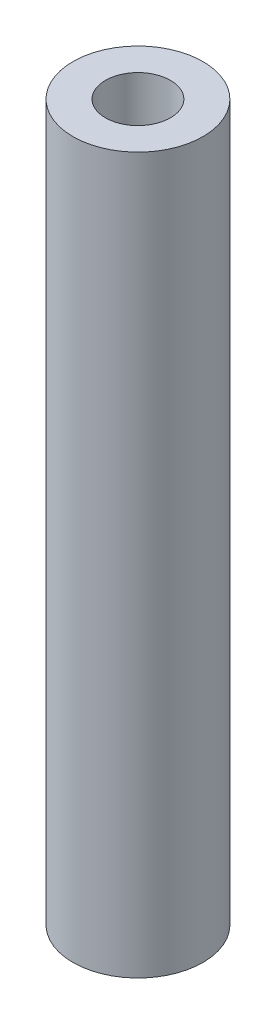
from build123d import *

# Parameters (mm, degrees)
SKETCH1_R      = 3
SKETCH1_R_2    = 1.5
STANDOFF_DEPTH = 33


with BuildPart() as part:
    # Sketch1 → standoff (new body)
    with BuildSketch(Plane(origin=(0, 0, 0), x_dir=(1, 0, 0), z_dir=(0, 1, 0))):
        Circle(SKETCH1_R)
        Circle(SKETCH1_R_2, mode=Mode.SUBTRACT)
    extrude(amount=STANDOFF_DEPTH)


solid = part.part
